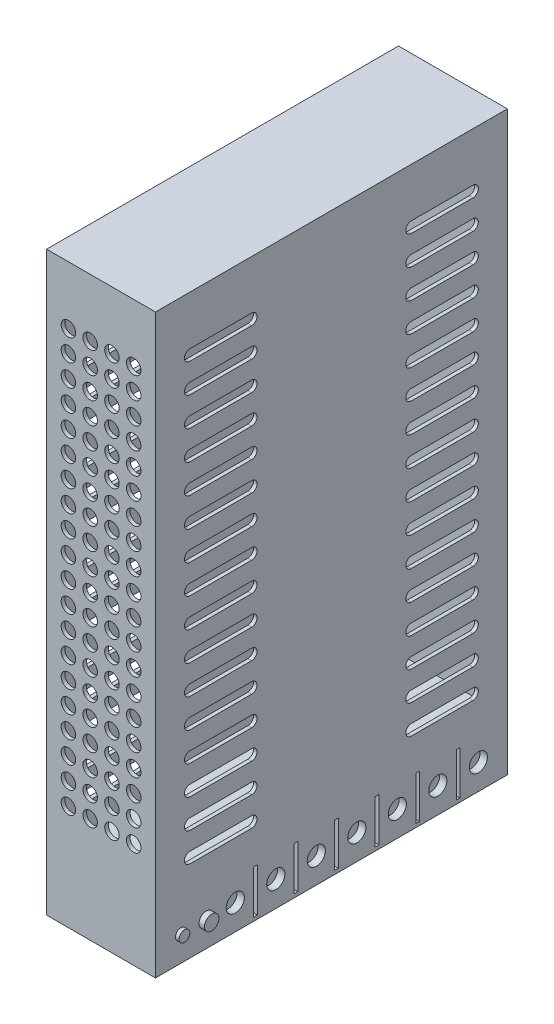
from build123d import *

# Parameters (mm, degrees)
SKETCH1_W            = 30
SKETCH1_H            = 145
CASE_2_DEPTH         = 97
CASE_SHELL_T         = 1
SKETCH2_W            = 30
SKETCH2_H            = 14
TERMINAL_BLOCK_DEPTH = 97
SKETCH3_R            = 2
POT_DEPTH            = 1.5
SKETCH4_R            = 1.5
LED_DEPTH            = 1
SKETCH5_R            = 2
PERFORATION_DEPTH    = 1
VENTS_R_DEPTH        = 1
VENTS_L_START        = 1
VENTS_L_DEPTH        = 1
SKETCH8_R            = 2.5
SCREWS_DEPTH         = 2
SKETCH9_W            = 1
SKETCH9_H            = 12
BARRIERS_DEPTH       = 3


with BuildPart() as part:
    # Sketch1 → Case 2 (new body)
    with BuildSketch(Plane.XY):
        with Locations((0, 86.5)):
            Rectangle(SKETCH1_W, SKETCH1_H)
    extrude(amount=CASE_2_DEPTH)

    # Case_shell (no face opened: a closed hollow body)
    add(offset(amount=-CASE_SHELL_T, mode=Mode.PRIVATE), mode=Mode.SUBTRACT)

    # Sketch2 → Terminal_block (add)
    with BuildSketch(Plane.XY):
        with Locations((0, 7)):
            Rectangle(SKETCH2_W, SKETCH2_H)
    extrude(amount=TERMINAL_BLOCK_DEPTH)

    # Sketch3 → Pot (add)
    with BuildSketch(Plane(origin=(15, 0, 0), x_dir=(0, 0, -1), z_dir=(1, 0, 0))):
        with Locations((-83, 7)):
            Circle(SKETCH3_R)
    extrude(amount=POT_DEPTH)

    # Sketch4 → LED (add)
    with BuildSketch(Plane(origin=(15, 0, 0), x_dir=(0, 0, -1), z_dir=(1, 0, 0))):
        with Locations((-90, 7)):
            Circle(SKETCH4_R)
    extrude(amount=LED_DEPTH)

    # Sketch5 → Perforation (cut)
    with BuildSketch(Plane.XY.offset(97)):
        with Locations((-9, 29)):
            Circle(SKETCH5_R)
        with Locations((-9, 35)):
            Circle(SKETCH5_R)
        with Locations((-9, 41)):
            Circle(SKETCH5_R)
        with Locations((-9, 47)):
            Circle(SKETCH5_R)
        with Locations((-9, 53)):
            Circle(SKETCH5_R)
        with Locations((-9, 59)):
            Circle(SKETCH5_R)
        with Locations((-9, 65)):
            Circle(SKETCH5_R)
        with Locations((-9, 71)):
            Circle(SKETCH5_R)
        with Locations((-9, 77)):
            Circle(SKETCH5_R)
        with Locations((-9, 83)):
            Circle(SKETCH5_R)
        with Locations((-9, 89)):
            Circle(SKETCH5_R)
        with Locations((-9, 95)):
            Circle(SKETCH5_R)
        with Locations((-9, 101)):
            Circle(SKETCH5_R)
        with Locations((-9, 107)):
            Circle(SKETCH5_R)
        with Locations((-9, 113)):
            Circle(SKETCH5_R)
        with Locations((-9, 119)):
            Circle(SKETCH5_R)
        with Locations((-9, 125)):
            Circle(SKETCH5_R)
        with Locations((-9, 131)):
            Circle(SKETCH5_R)
        with Locations((-9, 137)):
            Circle(SKETCH5_R)
        with Locations((-9, 143)):
            Circle(SKETCH5_R)
        with Locations((-3, 29)):
            Circle(SKETCH5_R)
        with Locations((-3, 35)):
            Circle(SKETCH5_R)
        with Locations((-3, 41)):
            Circle(SKETCH5_R)
        with Locations((-3, 47)):
            Circle(SKETCH5_R)
        with Locations((-3, 53)):
            Circle(SKETCH5_R)
        with Locations((-3, 59)):
            Circle(SKETCH5_R)
        with Locations((-3, 65)):
            Circle(SKETCH5_R)
        with Locations((-3, 71)):
            Circle(SKETCH5_R)
        with Locations((-3, 77)):
            Circle(SKETCH5_R)
        with Locations((-3, 83)):
            Circle(SKETCH5_R)
        with Locations((-3, 89)):
            Circle(SKETCH5_R)
        with Locations((-3, 95)):
            Circle(SKETCH5_R)
        with Locations((-3, 101)):
            Circle(SKETCH5_R)
        with Locations((-3, 107)):
            Circle(SKETCH5_R)
        with Locations((-3, 113)):
            Circle(SKETCH5_R)
        with Locations((-3, 119)):
            Circle(SKETCH5_R)
        with Locations((-3, 125)):
            Circle(SKETCH5_R)
        with Locations((-3, 131)):
            Circle(SKETCH5_R)
        with Locations((-3, 137)):
            Circle(SKETCH5_R)
        with Locations((-3, 143)):
            Circle(SKETCH5_R)
        with Locations((3, 29)):
            Circle(SKETCH5_R)
        with Locations((3, 35)):
            Circle(SKETCH5_R)
        with Locations((3, 41)):
            Circle(SKETCH5_R)
        with Locations((3, 47)):
            Circle(SKETCH5_R)
        with Locations((3, 53)):
            Circle(SKETCH5_R)
        with Locations((3, 59)):
            Circle(SKETCH5_R)
        with Locations((3, 65)):
            Circle(SKETCH5_R)
        with Locations((3, 71)):
            Circle(SKETCH5_R)
        with Locations((3, 77)):
            Circle(SKETCH5_R)
        with Locations((3, 83)):
            Circle(SKETCH5_R)
        with Locations((3, 89)):
            Circle(SKETCH5_R)
        with Locations((3, 95)):
            Circle(SKETCH5_R)
        with Locations((3, 101)):
            Circle(SKETCH5_R)
        with Locations((3, 107)):
            Circle(SKETCH5_R)
        with Locations((3, 113)):
            Circle(SKETCH5_R)
        with Locations((3, 119)):
            Circle(SKETCH5_R)
        with Locations((3, 125)):
            Circle(SKETCH5_R)
        with Locations((3, 131)):
            Circle(SKETCH5_R)
        with Locations((3, 137)):
            Circle(SKETCH5_R)
        with Locations((3, 143)):
            Circle(SKETCH5_R)
        with Locations((9, 29)):
            Circle(SKETCH5_R)
        with Locations((9, 35)):
            Circle(SKETCH5_R)
        with Locations((9, 41)):
            Circle(SKETCH5_R)
        with Locations((9, 47)):
            Circle(SKETCH5_R)
        with Locations((9, 53)):
            Circle(SKETCH5_R)
        with Locations((9, 59)):
            Circle(SKETCH5_R)
        with Locations((9, 65)):
            Circle(SKETCH5_R)
        with Locations((9, 71)):
            Circle(SKETCH5_R)
        with Locations((9, 77)):
            Circle(SKETCH5_R)
        with Locations((9, 83)):
            Circle(SKETCH5_R)
        with Locations((9, 89)):
            Circle(SKETCH5_R)
        with Locations((9, 95)):
            Circle(SKETCH5_R)
        with Locations((9, 101)):
            Circle(SKETCH5_R)
        with Locations((9, 107)):
            Circle(SKETCH5_R)
        with Locations((9, 113)):
            Circle(SKETCH5_R)
        with Locations((9, 119)):
            Circle(SKETCH5_R)
        with Locations((9, 125)):
            Circle(SKETCH5_R)
        with Locations((9, 131)):
            Circle(SKETCH5_R)
        with Locations((9, 137)):
            Circle(SKETCH5_R)
        with Locations((9, 143)):
            Circle(SKETCH5_R)
    extrude(amount=-PERFORATION_DEPTH, mode=Mode.SUBTRACT)

    # Sketch6 → Vents_R (cut)
    with BuildSketch(Plane(origin=(15, 0, 0), x_dir=(0, 0, -1), z_dir=(1, 0, 0))):
        with BuildLine():
            Line((-9.5, 22.5), (-26.5, 22.5))
            ThreePointArc((-26.5, 22.5), (-28, 24), (-26.5, 25.5))
            Line((-26.5, 25.5), (-9.5, 25.5))
            ThreePointArc((-9.5, 25.5), (-8, 24), (-9.5, 22.5))
        make_face()
        with BuildLine():
            Line((-70.5, 22.5), (-87.5, 22.5))
            ThreePointArc((-87.5, 22.5), (-89, 24), (-87.5, 25.5))
            Line((-87.5, 25.5), (-70.5, 25.5))
            ThreePointArc((-70.5, 25.5), (-69, 24), (-70.5, 22.5))
        make_face()
        with BuildLine():
            Line((-9.5, 30.5), (-26.5, 30.5))
            ThreePointArc((-26.5, 30.5), (-28, 32), (-26.5, 33.5))
            Line((-26.5, 33.5), (-9.5, 33.5))
            ThreePointArc((-9.5, 33.5), (-8, 32), (-9.5, 30.5))
        make_face()
        with BuildLine():
            Line((-70.5, 30.5), (-87.5, 30.5))
            ThreePointArc((-87.5, 30.5), (-89, 32), (-87.5, 33.5))
            Line((-87.5, 33.5), (-70.5, 33.5))
            ThreePointArc((-70.5, 33.5), (-69, 32), (-70.5, 30.5))
        make_face()
        with BuildLine():
            Line((-9.5, 38.5), (-26.5, 38.5))
            ThreePointArc((-26.5, 38.5), (-28, 40), (-26.5, 41.5))
            Line((-26.5, 41.5), (-9.5, 41.5))
            ThreePointArc((-9.5, 41.5), (-8, 40), (-9.5, 38.5))
        make_face()
        with BuildLine():
            Line((-70.5, 38.5), (-87.5, 38.5))
            ThreePointArc((-87.5, 38.5), (-89, 40), (-87.5, 41.5))
            Line((-87.5, 41.5), (-70.5, 41.5))
            ThreePointArc((-70.5, 41.5), (-69, 40), (-70.5, 38.5))
        make_face()
        with BuildLine():
            Line((-9.5, 46.5), (-26.5, 46.5))
            ThreePointArc((-26.5, 46.5), (-28, 48), (-26.5, 49.5))
            Line((-26.5, 49.5), (-9.5, 49.5))
            ThreePointArc((-9.5, 49.5), (-8, 48), (-9.5, 46.5))
        make_face()
        with BuildLine():
            Line((-70.5, 46.5), (-87.5, 46.5))
            ThreePointArc((-87.5, 46.5), (-89, 48), (-87.5, 49.5))
            Line((-87.5, 49.5), (-70.5, 49.5))
            ThreePointArc((-70.5, 49.5), (-69, 48), (-70.5, 46.5))
        make_face()
        with BuildLine():
            Line((-9.5, 54.5), (-26.5, 54.5))
            ThreePointArc((-26.5, 54.5), (-28, 56), (-26.5, 57.5))
            Line((-26.5, 57.5), (-9.5, 57.5))
            ThreePointArc((-9.5, 57.5), (-8, 56), (-9.5, 54.5))
        make_face()
        with BuildLine():
            Line((-70.5, 54.5), (-87.5, 54.5))
            ThreePointArc((-87.5, 54.5), (-89, 56), (-87.5, 57.5))
            Line((-87.5, 57.5), (-70.5, 57.5))
            ThreePointArc((-70.5, 57.5), (-69, 56), (-70.5, 54.5))
        make_face()
        with BuildLine():
            Line((-9.5, 62.5), (-26.5, 62.5))
            ThreePointArc((-26.5, 62.5), (-28, 64), (-26.5, 65.5))
            Line((-26.5, 65.5), (-9.5, 65.5))
            ThreePointArc((-9.5, 65.5), (-8, 64), (-9.5, 62.5))
        make_face()
        with BuildLine():
            Line((-70.5, 62.5), (-87.5, 62.5))
            ThreePointArc((-87.5, 62.5), (-89, 64), (-87.5, 65.5))
            Line((-87.5, 65.5), (-70.5, 65.5))
            ThreePointArc((-70.5, 65.5), (-69, 64), (-70.5, 62.5))
        make_face()
        with BuildLine():
            Line((-9.5, 70.5), (-26.5, 70.5))
            ThreePointArc((-26.5, 70.5), (-28, 72), (-26.5, 73.5))
            Line((-26.5, 73.5), (-9.5, 73.5))
            ThreePointArc((-9.5, 73.5), (-8, 72), (-9.5, 70.5))
        make_face()
        with BuildLine():
            Line((-70.5, 70.5), (-87.5, 70.5))
            ThreePointArc((-87.5, 70.5), (-89, 72), (-87.5, 73.5))
            Line((-87.5, 73.5), (-70.5, 73.5))
            ThreePointArc((-70.5, 73.5), (-69, 72), (-70.5, 70.5))
        make_face()
        with BuildLine():
            Line((-9.5, 78.5), (-26.5, 78.5))
            ThreePointArc((-26.5, 78.5), (-28, 80), (-26.5, 81.5))
            Line((-26.5, 81.5), (-9.5, 81.5))
            ThreePointArc((-9.5, 81.5), (-8, 80), (-9.5, 78.5))
        make_face()
        with BuildLine():
            Line((-70.5, 78.5), (-87.5, 78.5))
            ThreePointArc((-87.5, 78.5), (-89, 80), (-87.5, 81.5))
            Line((-87.5, 81.5), (-70.5, 81.5))
            ThreePointArc((-70.5, 81.5), (-69, 80), (-70.5, 78.5))
        make_face()
        with BuildLine():
            Line((-9.5, 86.5), (-26.5, 86.5))
            ThreePointArc((-26.5, 86.5), (-28, 88), (-26.5, 89.5))
            Line((-26.5, 89.5), (-9.5, 89.5))
            ThreePointArc((-9.5, 89.5), (-8, 88), (-9.5, 86.5))
        make_face()
        with BuildLine():
            Line((-70.5, 86.5), (-87.5, 86.5))
            ThreePointArc((-87.5, 86.5), (-89, 88), (-87.5, 89.5))
            Line((-87.5, 89.5), (-70.5, 89.5))
            ThreePointArc((-70.5, 89.5), (-69, 88), (-70.5, 86.5))
        make_face()
        with BuildLine():
            Line((-9.5, 94.5), (-26.5, 94.5))
            ThreePointArc((-26.5, 94.5), (-28, 96), (-26.5, 97.5))
            Line((-26.5, 97.5), (-9.5, 97.5))
            ThreePointArc((-9.5, 97.5), (-8, 96), (-9.5, 94.5))
        make_face()
        with BuildLine():
            Line((-70.5, 94.5), (-87.5, 94.5))
            ThreePointArc((-87.5, 94.5), (-89, 96), (-87.5, 97.5))
            Line((-87.5, 97.5), (-70.5, 97.5))
            ThreePointArc((-70.5, 97.5), (-69, 96), (-70.5, 94.5))
        make_face()
        with BuildLine():
            Line((-9.5, 102.5), (-26.5, 102.5))
            ThreePointArc((-26.5, 102.5), (-28, 104), (-26.5, 105.5))
            Line((-26.5, 105.5), (-9.5, 105.5))
            ThreePointArc((-9.5, 105.5), (-8, 104), (-9.5, 102.5))
        make_face()
        with BuildLine():
            Line((-70.5, 102.5), (-87.5, 102.5))
            ThreePointArc((-87.5, 102.5), (-89, 104), (-87.5, 105.5))
            Line((-87.5, 105.5), (-70.5, 105.5))
            ThreePointArc((-70.5, 105.5), (-69, 104), (-70.5, 102.5))
        make_face()
        with BuildLine():
            Line((-9.5, 110.5), (-26.5, 110.5))
            ThreePointArc((-26.5, 110.5), (-28, 112), (-26.5, 113.5))
            Line((-26.5, 113.5), (-9.5, 113.5))
            ThreePointArc((-9.5, 113.5), (-8, 112), (-9.5, 110.5))
        make_face()
        with BuildLine():
            Line((-70.5, 110.5), (-87.5, 110.5))
            ThreePointArc((-87.5, 110.5), (-89, 112), (-87.5, 113.5))
            Line((-87.5, 113.5), (-70.5, 113.5))
            ThreePointArc((-70.5, 113.5), (-69, 112), (-70.5, 110.5))
        make_face()
        with BuildLine():
            Line((-9.5, 118.5), (-26.5, 118.5))
            ThreePointArc((-26.5, 118.5), (-28, 120), (-26.5, 121.5))
            Line((-26.5, 121.5), (-9.5, 121.5))
            ThreePointArc((-9.5, 121.5), (-8, 120), (-9.5, 118.5))
        make_face()
        with BuildLine():
            Line((-70.5, 118.5), (-87.5, 118.5))
            ThreePointArc((-87.5, 118.5), (-89, 120), (-87.5, 121.5))
            Line((-87.5, 121.5), (-70.5, 121.5))
            ThreePointArc((-70.5, 121.5), (-69, 120), (-70.5, 118.5))
        make_face()
        with BuildLine():
            Line((-9.5, 126.5), (-26.5, 126.5))
            ThreePointArc((-26.5, 126.5), (-28, 128), (-26.5, 129.5))
            Line((-26.5, 129.5), (-9.5, 129.5))
            ThreePointArc((-9.5, 129.5), (-8, 128), (-9.5, 126.5))
        make_face()
        with BuildLine():
            Line((-70.5, 126.5), (-87.5, 126.5))
            ThreePointArc((-87.5, 126.5), (-89, 128), (-87.5, 129.5))
            Line((-87.5, 129.5), (-70.5, 129.5))
            ThreePointArc((-70.5, 129.5), (-69, 128), (-70.5, 126.5))
        make_face()
        with BuildLine():
            Line((-9.5, 134.5), (-26.5, 134.5))
            ThreePointArc((-26.5, 134.5), (-28, 136), (-26.5, 137.5))
            Line((-26.5, 137.5), (-9.5, 137.5))
            ThreePointArc((-9.5, 137.5), (-8, 136), (-9.5, 134.5))
        make_face()
        with BuildLine():
            Line((-70.5, 134.5), (-87.5, 134.5))
            ThreePointArc((-87.5, 134.5), (-89, 136), (-87.5, 137.5))
            Line((-87.5, 137.5), (-70.5, 137.5))
            ThreePointArc((-70.5, 137.5), (-69, 136), (-70.5, 134.5))
        make_face()
        with BuildLine():
            Line((-9.5, 142.5), (-26.5, 142.5))
            ThreePointArc((-26.5, 142.5), (-28, 144), (-26.5, 145.5))
            Line((-26.5, 145.5), (-9.5, 145.5))
            ThreePointArc((-9.5, 145.5), (-8, 144), (-9.5, 142.5))
        make_face()
        with BuildLine():
            Line((-70.5, 142.5), (-87.5, 142.5))
            ThreePointArc((-87.5, 142.5), (-89, 144), (-87.5, 145.5))
            Line((-87.5, 145.5), (-70.5, 145.5))
            ThreePointArc((-70.5, 145.5), (-69, 144), (-70.5, 142.5))
        make_face()
    extrude(amount=-VENTS_R_DEPTH, mode=Mode.SUBTRACT)

    # Sketch7 → Vents_L (cut)
    with BuildSketch(Plane(origin=(-15, 0, 0), x_dir=(0, 0, -1), z_dir=(1, 0, 0)).offset(VENTS_L_START)):
        with BuildLine():
            Line((-9.5, 22.5), (-26.5, 22.5))
            ThreePointArc((-26.5, 22.5), (-28, 24), (-26.5, 25.5))
            Line((-26.5, 25.5), (-9.5, 25.5))
            ThreePointArc((-9.5, 25.5), (-8, 24), (-9.5, 22.5))
        make_face()
        with BuildLine():
            Line((-70.5, 22.5), (-87.5, 22.5))
            ThreePointArc((-87.5, 22.5), (-89, 24), (-87.5, 25.5))
            Line((-87.5, 25.5), (-70.5, 25.5))
            ThreePointArc((-70.5, 25.5), (-69, 24), (-70.5, 22.5))
        make_face()
        with BuildLine():
            Line((-9.5, 30.5), (-26.5, 30.5))
            ThreePointArc((-26.5, 30.5), (-28, 32), (-26.5, 33.5))
            Line((-26.5, 33.5), (-9.5, 33.5))
            ThreePointArc((-9.5, 33.5), (-8, 32), (-9.5, 30.5))
        make_face()
        with BuildLine():
            Line((-70.5, 30.5), (-87.5, 30.5))
            ThreePointArc((-87.5, 30.5), (-89, 32), (-87.5, 33.5))
            Line((-87.5, 33.5), (-70.5, 33.5))
            ThreePointArc((-70.5, 33.5), (-69, 32), (-70.5, 30.5))
        make_face()
        with BuildLine():
            Line((-9.5, 38.5), (-26.5, 38.5))
            ThreePointArc((-26.5, 38.5), (-28, 40), (-26.5, 41.5))
            Line((-26.5, 41.5), (-9.5, 41.5))
            ThreePointArc((-9.5, 41.5), (-8, 40), (-9.5, 38.5))
        make_face()
        with BuildLine():
            Line((-70.5, 38.5), (-87.5, 38.5))
            ThreePointArc((-87.5, 38.5), (-89, 40), (-87.5, 41.5))
            Line((-87.5, 41.5), (-70.5, 41.5))
            ThreePointArc((-70.5, 41.5), (-69, 40), (-70.5, 38.5))
        make_face()
        with BuildLine():
            Line((-9.5, 46.5), (-26.5, 46.5))
            ThreePointArc((-26.5, 46.5), (-28, 48), (-26.5, 49.5))
            Line((-26.5, 49.5), (-9.5, 49.5))
            ThreePointArc((-9.5, 49.5), (-8, 48), (-9.5, 46.5))
        make_face()
        with BuildLine():
            Line((-70.5, 46.5), (-87.5, 46.5))
            ThreePointArc((-87.5, 46.5), (-89, 48), (-87.5, 49.5))
            Line((-87.5, 49.5), (-70.5, 49.5))
            ThreePointArc((-70.5, 49.5), (-69, 48), (-70.5, 46.5))
        make_face()
        with BuildLine():
            Line((-9.5, 54.5), (-26.5, 54.5))
            ThreePointArc((-26.5, 54.5), (-28, 56), (-26.5, 57.5))
            Line((-26.5, 57.5), (-9.5, 57.5))
            ThreePointArc((-9.5, 57.5), (-8, 56), (-9.5, 54.5))
        make_face()
        with BuildLine():
            Line((-70.5, 54.5), (-87.5, 54.5))
            ThreePointArc((-87.5, 54.5), (-89, 56), (-87.5, 57.5))
            Line((-87.5, 57.5), (-70.5, 57.5))
            ThreePointArc((-70.5, 57.5), (-69, 56), (-70.5, 54.5))
        make_face()
        with BuildLine():
            Line((-9.5, 62.5), (-26.5, 62.5))
            ThreePointArc((-26.5, 62.5), (-28, 64), (-26.5, 65.5))
            Line((-26.5, 65.5), (-9.5, 65.5))
            ThreePointArc((-9.5, 65.5), (-8, 64), (-9.5, 62.5))
        make_face()
        with BuildLine():
            Line((-70.5, 62.5), (-87.5, 62.5))
            ThreePointArc((-87.5, 62.5), (-89, 64), (-87.5, 65.5))
            Line((-87.5, 65.5), (-70.5, 65.5))
            ThreePointArc((-70.5, 65.5), (-69, 64), (-70.5, 62.5))
        make_face()
        with BuildLine():
            Line((-9.5, 70.5), (-26.5, 70.5))
            ThreePointArc((-26.5, 70.5), (-28, 72), (-26.5, 73.5))
            Line((-26.5, 73.5), (-9.5, 73.5))
            ThreePointArc((-9.5, 73.5), (-8, 72), (-9.5, 70.5))
        make_face()
        with BuildLine():
            Line((-70.5, 70.5), (-87.5, 70.5))
            ThreePointArc((-87.5, 70.5), (-89, 72), (-87.5, 73.5))
            Line((-87.5, 73.5), (-70.5, 73.5))
            ThreePointArc((-70.5, 73.5), (-69, 72), (-70.5, 70.5))
        make_face()
        with BuildLine():
            Line((-9.5, 78.5), (-26.5, 78.5))
            ThreePointArc((-26.5, 78.5), (-28, 80), (-26.5, 81.5))
            Line((-26.5, 81.5), (-9.5, 81.5))
            ThreePointArc((-9.5, 81.5), (-8, 80), (-9.5, 78.5))
        make_face()
        with BuildLine():
            Line((-70.5, 78.5), (-87.5, 78.5))
            ThreePointArc((-87.5, 78.5), (-89, 80), (-87.5, 81.5))
            Line((-87.5, 81.5), (-70.5, 81.5))
            ThreePointArc((-70.5, 81.5), (-69, 80), (-70.5, 78.5))
        make_face()
        with BuildLine():
            Line((-9.5, 86.5), (-26.5, 86.5))
            ThreePointArc((-26.5, 86.5), (-28, 88), (-26.5, 89.5))
            Line((-26.5, 89.5), (-9.5, 89.5))
            ThreePointArc((-9.5, 89.5), (-8, 88), (-9.5, 86.5))
        make_face()
        with BuildLine():
            Line((-70.5, 86.5), (-87.5, 86.5))
            ThreePointArc((-87.5, 86.5), (-89, 88), (-87.5, 89.5))
            Line((-87.5, 89.5), (-70.5, 89.5))
            ThreePointArc((-70.5, 89.5), (-69, 88), (-70.5, 86.5))
        make_face()
        with BuildLine():
            Line((-9.5, 94.5), (-26.5, 94.5))
            ThreePointArc((-26.5, 94.5), (-28, 96), (-26.5, 97.5))
            Line((-26.5, 97.5), (-9.5, 97.5))
            ThreePointArc((-9.5, 97.5), (-8, 96), (-9.5, 94.5))
        make_face()
        with BuildLine():
            Line((-70.5, 94.5), (-87.5, 94.5))
            ThreePointArc((-87.5, 94.5), (-89, 96), (-87.5, 97.5))
            Line((-87.5, 97.5), (-70.5, 97.5))
            ThreePointArc((-70.5, 97.5), (-69, 96), (-70.5, 94.5))
        make_face()
        with BuildLine():
            Line((-9.5, 102.5), (-26.5, 102.5))
            ThreePointArc((-26.5, 102.5), (-28, 104), (-26.5, 105.5))
            Line((-26.5, 105.5), (-9.5, 105.5))
            ThreePointArc((-9.5, 105.5), (-8, 104), (-9.5, 102.5))
        make_face()
        with BuildLine():
            Line((-70.5, 102.5), (-87.5, 102.5))
            ThreePointArc((-87.5, 102.5), (-89, 104), (-87.5, 105.5))
            Line((-87.5, 105.5), (-70.5, 105.5))
            ThreePointArc((-70.5, 105.5), (-69, 104), (-70.5, 102.5))
        make_face()
        with BuildLine():
            Line((-9.5, 110.5), (-26.5, 110.5))
            ThreePointArc((-26.5, 110.5), (-28, 112), (-26.5, 113.5))
            Line((-26.5, 113.5), (-9.5, 113.5))
            ThreePointArc((-9.5, 113.5), (-8, 112), (-9.5, 110.5))
        make_face()
        with BuildLine():
            Line((-70.5, 110.5), (-87.5, 110.5))
            ThreePointArc((-87.5, 110.5), (-89, 112), (-87.5, 113.5))
            Line((-87.5, 113.5), (-70.5, 113.5))
            ThreePointArc((-70.5, 113.5), (-69, 112), (-70.5, 110.5))
        make_face()
        with BuildLine():
            Line((-9.5, 118.5), (-26.5, 118.5))
            ThreePointArc((-26.5, 118.5), (-28, 120), (-26.5, 121.5))
            Line((-26.5, 121.5), (-9.5, 121.5))
            ThreePointArc((-9.5, 121.5), (-8, 120), (-9.5, 118.5))
        make_face()
        with BuildLine():
            Line((-70.5, 118.5), (-87.5, 118.5))
            ThreePointArc((-87.5, 118.5), (-89, 120), (-87.5, 121.5))
            Line((-87.5, 121.5), (-70.5, 121.5))
            ThreePointArc((-70.5, 121.5), (-69, 120), (-70.5, 118.5))
        make_face()
        with BuildLine():
            Line((-9.5, 126.5), (-26.5, 126.5))
            ThreePointArc((-26.5, 126.5), (-28, 128), (-26.5, 129.5))
            Line((-26.5, 129.5), (-9.5, 129.5))
            ThreePointArc((-9.5, 129.5), (-8, 128), (-9.5, 126.5))
        make_face()
        with BuildLine():
            Line((-70.5, 126.5), (-87.5, 126.5))
            ThreePointArc((-87.5, 126.5), (-89, 128), (-87.5, 129.5))
            Line((-87.5, 129.5), (-70.5, 129.5))
            ThreePointArc((-70.5, 129.5), (-69, 128), (-70.5, 126.5))
        make_face()
        with BuildLine():
            Line((-9.5, 134.5), (-26.5, 134.5))
            ThreePointArc((-26.5, 134.5), (-28, 136), (-26.5, 137.5))
            Line((-26.5, 137.5), (-9.5, 137.5))
            ThreePointArc((-9.5, 137.5), (-8, 136), (-9.5, 134.5))
        make_face()
        with BuildLine():
            Line((-70.5, 134.5), (-87.5, 134.5))
            ThreePointArc((-87.5, 134.5), (-89, 136), (-87.5, 137.5))
            Line((-87.5, 137.5), (-70.5, 137.5))
            ThreePointArc((-70.5, 137.5), (-69, 136), (-70.5, 134.5))
        make_face()
        with BuildLine():
            Line((-9.5, 142.5), (-26.5, 142.5))
            ThreePointArc((-26.5, 142.5), (-28, 144), (-26.5, 145.5))
            Line((-26.5, 145.5), (-9.5, 145.5))
            ThreePointArc((-9.5, 145.5), (-8, 144), (-9.5, 142.5))
        make_face()
        with BuildLine():
            Line((-70.5, 142.5), (-87.5, 142.5))
            ThreePointArc((-87.5, 142.5), (-89, 144), (-87.5, 145.5))
            Line((-87.5, 145.5), (-70.5, 145.5))
            ThreePointArc((-70.5, 145.5), (-69, 144), (-70.5, 142.5))
        make_face()
    extrude(amount=-VENTS_L_DEPTH, mode=Mode.SUBTRACT)

    # Sketch8 → Screws (cut)
    with BuildSketch(Plane(origin=(15, 0, 0), x_dir=(0, 0, -1), z_dir=(1, 0, 0))):
        with Locations((-8, 7)):
            Circle(SKETCH8_R)
        with Locations((-19.166666667, 7)):
            Circle(SKETCH8_R)
        with Locations((-30.333333333, 7)):
            Circle(SKETCH8_R)
        with Locations((-41.5, 7)):
            Circle(SKETCH8_R)
        with Locations((-52.666666667, 7)):
            Circle(SKETCH8_R)
        with Locations((-63.833333333, 7)):
            Circle(SKETCH8_R)
        with Locations((-75, 7)):
            Circle(SKETCH8_R)
    extrude(amount=-SCREWS_DEPTH, mode=Mode.SUBTRACT)

    # Sketch9 → Barriers (cut)
    with BuildSketch(Plane(origin=(15, 0, 0), x_dir=(0, 0, -1), z_dir=(1, 0, 0))):
        with Locations((-13.583333333, 7)):
            Rectangle(SKETCH9_W, SKETCH9_H)
        with Locations((-24.75, 7)):
            Rectangle(SKETCH9_W, SKETCH9_H)
        with Locations((-35.916666667, 7)):
            Rectangle(SKETCH9_W, SKETCH9_H)
        with Locations((-47.083333333, 7)):
            Rectangle(SKETCH9_W, SKETCH9_H)
        with Locations((-58.25, 7)):
            Rectangle(SKETCH9_W, SKETCH9_H)
        with Locations((-69.416666667, 7)):
            Rectangle(SKETCH9_W, SKETCH9_H)
    extrude(amount=-BARRIERS_DEPTH, mode=Mode.SUBTRACT)


solid = part.part
